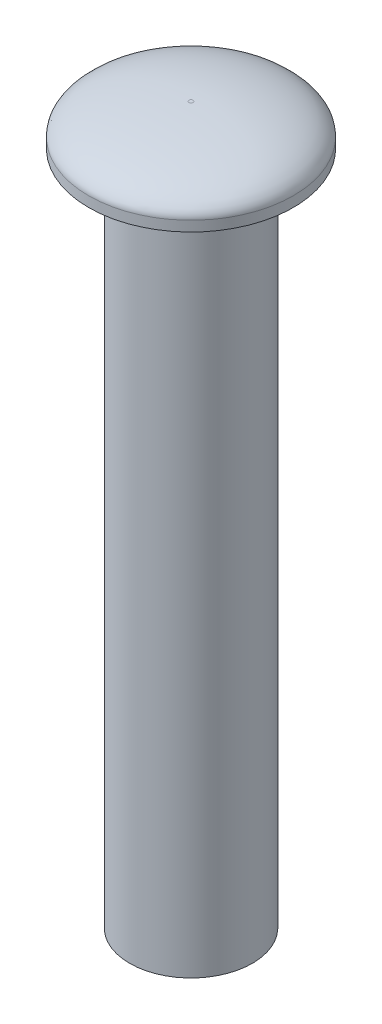
from build123d import *

# Parameters (mm, degrees)
FILLET1_SIZE   = 4.9
FILLET1_SIZE_2 = 1.5


with BuildPart() as part:
    # Sketch1 → Revolve1 (revolve)
    with BuildSketch(Plane(origin=(0, 0, 0), x_dir=(0, 0, -1), z_dir=(1, 0, 0)), mode=Mode.PRIVATE) as revolve1_sk:
        Polygon((3, -1), (0, -1), (0, -27), (2.4, -27), (2.4, -34), (3, -34), align=None)
        Polygon((5, 1), (0, 1), (0, -1), (3, -1), (5, -1), align=None)
    revolve(revolve1_sk.sketch.rotate(Axis((0, 1, 0), (0, -1, 0)), 180), axis=Axis((0, 1, 0), (0, -1, 0)))

    # Fillet1
    # an asymmetric fillet: 4.9, 1.5 mm, written as the material it takes off along each edge
    with BuildSketch(Plane(origin=(0, 1, 0), x_dir=(0, 0, 1), z_dir=(1, 0, 0))) as fillet1_piece_1:
        with BuildLine():
            Bezier((5 - FILLET1_SIZE, 0), (5, 0), (5, FILLET1_SIZE_2), weights=[1, 0.707106781, 1])
            Line((5, FILLET1_SIZE_2), (5, 0))
            Line((5, 0), (5 - FILLET1_SIZE, 0))
        make_face()
    revolve(axis=Axis((0, 1, 0), (0, -1, 0)), mode=Mode.SUBTRACT)


solid = part.part
